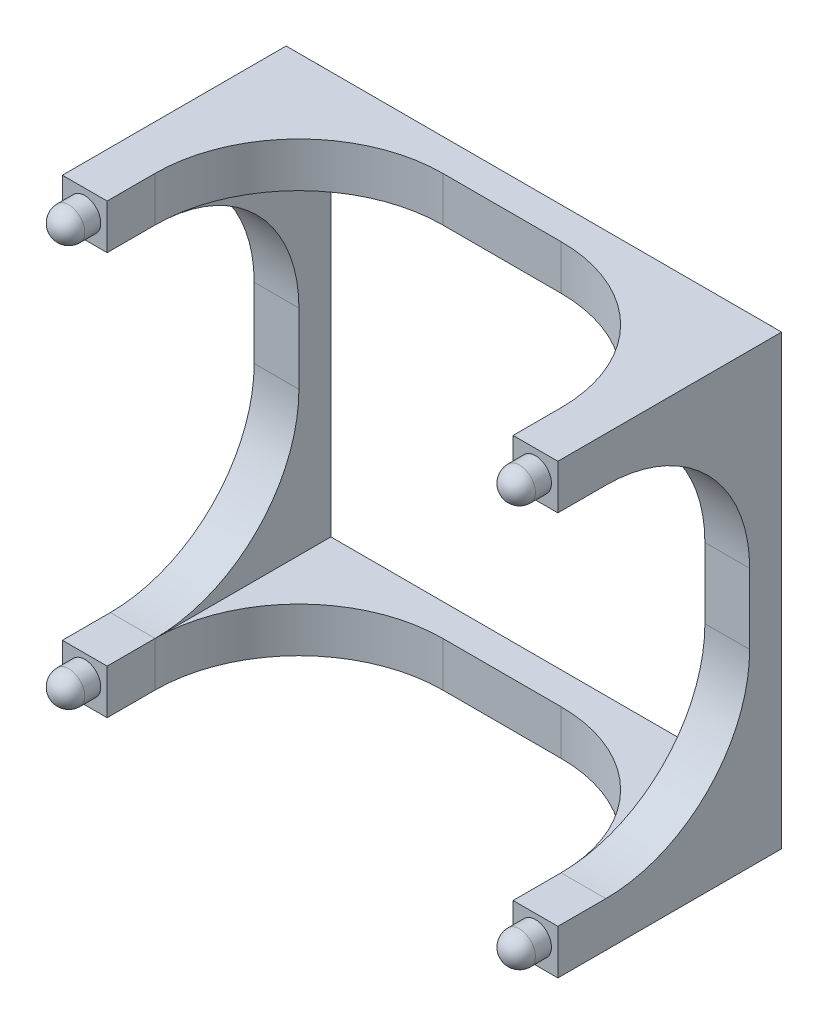
from build123d import *

# Parameters (mm, degrees)
SKIZZE1_W                       = 155
SKIZZE1_H                       = 140
SKIZZE1_W_2                     = 127
SKIZZE1_H_2                     = 112
AUFSATZ_LINEAR_AUSTRAGEN1_DEPTH = 10
SKIZZE2_W                       = 14
SKIZZE2_H                       = 14
AUFSATZ_LINEAR_AUSTRAGEN2_DEPTH = 60
SKIZZE3_R                       = 5
AUFSATZ_LINEAR_AUSTRAGEN3_DEPTH = 10
VERRUNDUNG1_R                   = 5
VERRUNDUNG3_R                   = 45
VERRUNDUNG4_R                   = 45
VERRUNDUNG6_R                   = 45
VERRUNDUNG7_R                   = 45
AUFSATZ_LINEAR_START            = 5
SKIZZE9_R                       = 5
AUFSATZ_LINEAR_AUSTRAGEN4_DEPTH = 5
VERRUNDUNG8_R                   = 5


# Some blends are built 0.0001 mm under size
with BuildPart() as part:
    # Skizze1 → Aufsatz-Linear austragen1 (new body)
    with BuildSketch(Plane.XY):
        Rectangle(SKIZZE1_W, SKIZZE1_H)
        Rectangle(SKIZZE1_W_2, SKIZZE1_H_2, mode=Mode.SUBTRACT)
    extrude(amount=AUFSATZ_LINEAR_AUSTRAGEN1_DEPTH)

    # Skizze2 → Aufsatz-Linear austragen2 (add)
    with BuildSketch(Plane.XY.offset(10)):
        with Locations((-70.5, 63)):
            Rectangle(SKIZZE2_W, SKIZZE2_H)
        with Locations((70.5, 63)):
            Rectangle(SKIZZE2_W, SKIZZE2_H)
        with Locations((70.5, -63)):
            Rectangle(SKIZZE2_W, SKIZZE2_H)
        with Locations((-70.5, -63)):
            Rectangle(SKIZZE2_W, SKIZZE2_H)
    extrude(amount=AUFSATZ_LINEAR_AUSTRAGEN2_DEPTH)

    # Skizze3 → Aufsatz-Linear austragen3 (add)
    with BuildSketch(Plane.XY.offset(70)):
        with Locations(Location((-70.5, -62.673227844, 0), (0, 0, 180))):
            Circle(SKIZZE3_R)
        with Locations((70.5, -62.673227844)):
            Circle(SKIZZE3_R)
        with Locations(Location((70.5, 63, 0), (0, 0, 180))):
            Circle(SKIZZE3_R)
        with Locations((-70.5, 63)):
            Circle(SKIZZE3_R)
    extrude(amount=AUFSATZ_LINEAR_AUSTRAGEN3_DEPTH)

    # Verrundung1
    verrundung1_edges = [part.edges().sort_by_distance(p)[0] for p in [
        (-65.5, -62.673227844, 80),
        (65.5, -62.673227844, 80),
        (75.5, 63, 80),
        (-75.5, 63, 80),
    ]]
    fillet(verrundung1_edges, radius=VERRUNDUNG1_R)

    # Verrundung3
    # the kernel refuses this fillet: 45 mm, written as the material it adds along each edge
    with BuildSketch(Plane(origin=(-63.5, -70, 10), x_dir=(0, 0, 1), z_dir=(0, 1, 0))) as verrundung3_piece_1:
        with BuildLine():
            CenterArc((VERRUNDUNG3_R, VERRUNDUNG3_R), VERRUNDUNG3_R, 180, 90)
            Line((0, VERRUNDUNG3_R), (0, 0))
            Line((0, 0), (VERRUNDUNG3_R, 0))
        make_face()
    extrude(amount=14)

    # Verrundung4
    verrundung4_edges = [part.edges().sort_by_distance(p)[0] for p in [
        (-70.5, -56, 10),
    ]]
    fillet(verrundung4_edges, radius=VERRUNDUNG4_R - 0.0001)  # a hair under: the kernel refuses the full size

    # Verrundung6
    # the kernel refuses this fillet: 45 mm, written as the material it adds along each edge
    with BuildSketch(Plane(origin=(-63.5, 70, 10), x_dir=(0, 0, 1), z_dir=(0, -1, 0)), Plane(origin=(63.5, 70, 10), x_dir=(-1, 0, 0), z_dir=(0, -1, 0)), Plane(origin=(63.5, -70, 10), x_dir=(0, 0, 1), z_dir=(0, 1, 0))) as verrundung6_piece_1:
        with BuildLine():
            CenterArc((VERRUNDUNG6_R, -VERRUNDUNG6_R), VERRUNDUNG6_R, 90, 90)
            Line((0, -VERRUNDUNG6_R), (0, 0))
            Line((0, 0), (VERRUNDUNG6_R, 0))
        make_face()
    extrude(amount=14)
    with BuildSketch(Plane(origin=(-63.5, 70, 10), x_dir=(0, 0, 1), z_dir=(0, -1, 0))) as verrundung6_piece_2_section:
        with BuildLine():
            CenterArc((VERRUNDUNG6_R, -VERRUNDUNG6_R), VERRUNDUNG6_R, 90, 90)
            Line((0, -VERRUNDUNG6_R), (0, 0))
            Line((0, 0), (VERRUNDUNG6_R, 0))
        make_face()
    verrundung6_piece_2 = extrude(amount=126.5, mode=Mode.PRIVATE)
    verrundung6_piece_2 = split(verrundung6_piece_2, bisect_by=Plane(origin=(-53.312219858, -56, 20.187780141), z_dir=(0, -1, 0)), keep=Keep.TOP, mode=Mode.PRIVATE)
    add(verrundung6_piece_2)
    with BuildSketch(Plane(origin=(63.5, 70, 10), x_dir=(-1, 0, 0), z_dir=(0, -1, 0))) as verrundung6_piece_3_section:
        with BuildLine():
            CenterArc((VERRUNDUNG6_R, -VERRUNDUNG6_R), VERRUNDUNG6_R, 90, 90)
            Line((0, -VERRUNDUNG6_R), (0, 0))
            Line((0, 0), (VERRUNDUNG6_R, 0))
        make_face()
    verrundung6_piece_3 = extrude(amount=126.5, mode=Mode.PRIVATE)
    verrundung6_piece_3 = split(verrundung6_piece_3, bisect_by=Plane(origin=(53.312219858, -56, 20.187780142), z_dir=(0, -1, 0)), keep=Keep.TOP, mode=Mode.PRIVATE)
    add(verrundung6_piece_3)
    with BuildSketch(Plane(origin=(63.5, -70, 10), x_dir=(0, 0, 1), z_dir=(0, 1, 0))) as verrundung6_piece_4_section:
        with BuildLine():
            CenterArc((VERRUNDUNG6_R, -VERRUNDUNG6_R), VERRUNDUNG6_R, 90, 90)
            Line((0, -VERRUNDUNG6_R), (0, 0))
            Line((0, 0), (VERRUNDUNG6_R, 0))
        make_face()
    verrundung6_piece_4 = extrude(amount=126.5, mode=Mode.PRIVATE)
    verrundung6_piece_4 = split(verrundung6_piece_4, bisect_by=Plane(origin=(53.312219858, 56, 20.187780142), z_dir=(0, 1, 0)), keep=Keep.TOP, mode=Mode.PRIVATE)
    add(verrundung6_piece_4)

    # Verrundung7
    verrundung7_edges = [part.edges().sort_by_distance(p)[0] for p in [
        (-70.5, 56, 10),
        (70.5, 56, 10),
        (70.5, -56, 10),
    ]]
    fillet(verrundung7_edges, radius=VERRUNDUNG7_R)

    # Skizze9 → Aufsatz-Linear austragen4 (add)
    with BuildSketch(Plane(origin=(0, 0, 0), x_dir=(-1, 0, 0), z_dir=(0, 0, -1)).offset(AUFSATZ_LINEAR_START)):
        with Locations((70.5, -62.673227844)):
            Circle(SKIZZE9_R)
        with Locations((70.5, 63)):
            Circle(SKIZZE9_R)
        with Locations((-70.5, 63)):
            Circle(SKIZZE9_R)
        with Locations((-70.5, -62.673227844)):
            Circle(SKIZZE9_R)
    extrude(amount=-AUFSATZ_LINEAR_AUSTRAGEN4_DEPTH)

    # Verrundung8
    verrundung8_edges = [part.edges().sort_by_distance(p)[0] for p in [
        (-65.5, -62.673227844, -5),
        (-65.5, 63, -5),
        (75.5, 63, -5),
        (75.5, -62.673227844, -5),
    ]]
    fillet(verrundung8_edges, radius=VERRUNDUNG8_R - 0.0001)  # a hair under: the kernel refuses the full size


solid = part.part
